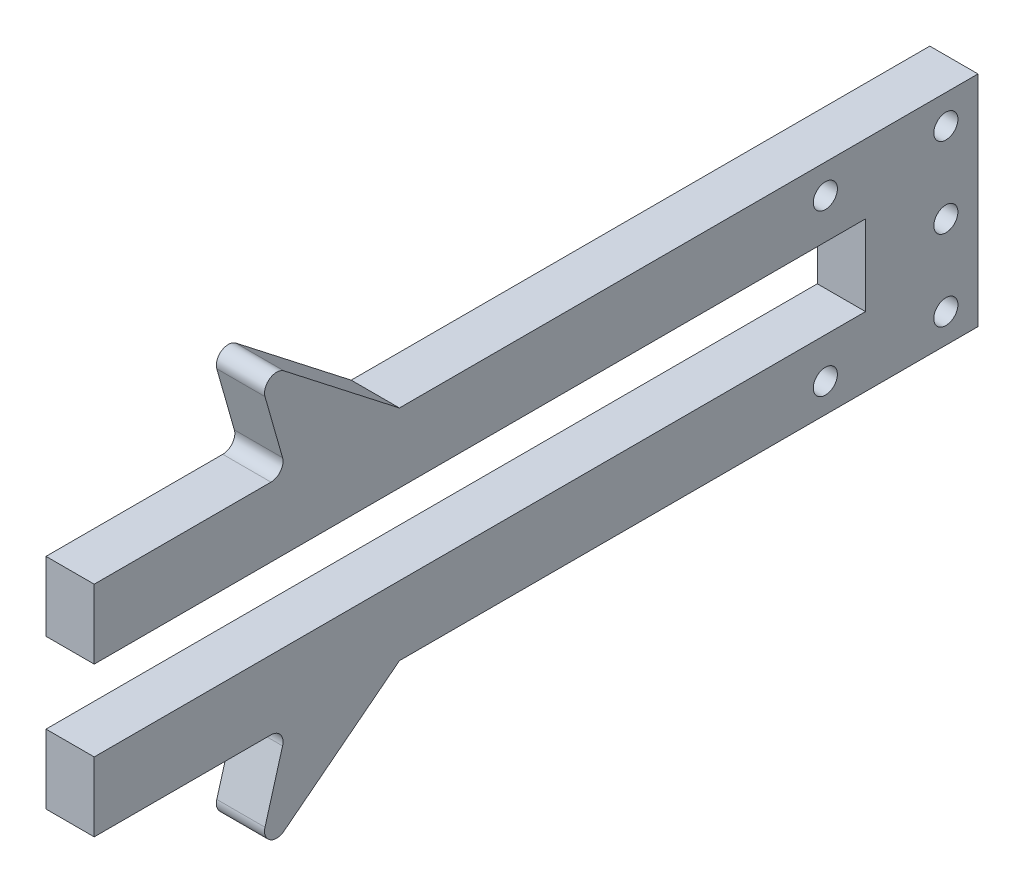
from build123d import *

# Parameters (mm, degrees)
BOSS_EXTRUDE1_DEPTH = 3
FILLET1_R           = 0.75
SKETCH3_R           = 0.75
CUT_EXTRUDE1_DEPTH  = 42.65740671


with BuildPart() as part:
    # Sketch2 → Boss-Extrude1 (new body)
    with BuildSketch(Plane(origin=(0, 0, 0), x_dir=(0, 0, -1), z_dir=(1, 0, 0))):
        Polygon((-20.913575794, -4.388518255), (-8.919601915, -4.388518255), (-10.913575794, 2.611481745), (-1.919601915, -4.388518255), (34.086424206, -4.388518255), (34.086424206, -18.00920791), (-1.919601915, -18.00920791), (-10.913575794, -25.00920791), (-8.919601915, -18.00920791), (-20.913575794, -18.00920791), (-20.913575794, -13.698863083), (27.086424206, -13.698863083), (27.086424206, -8.698863083), (-20.913575794, -8.698863083), align=None)
    extrude(amount=BOSS_EXTRUDE1_DEPTH)

    # Fillet1
    fillet1_edges = [part.edges().sort_by_distance(p)[0] for p in [
        (1.5, -25.00920791, 10.913575794),
        (1.5, -18.00920791, 8.919601915),
        (1.5, -4.388518255, 8.919601915),
        (1.5, 2.611481745, 10.913575794),
    ]]
    fillet(fillet1_edges, radius=FILLET1_R)

    # Sketch3 → Cut-Extrude1 (cut, through all)
    with BuildSketch(Plane(origin=(3, 0, 0), x_dir=(0, 0, -1), z_dir=(1, 0, 0))):
        with Locations((32.086424206, -6.198863083)):
            Circle(SKETCH3_R)
        with Locations((32.086424206, -16.198863083)):
            Circle(SKETCH3_R)
        with Locations((32.086424206, -11.198863083)):
            Circle(SKETCH3_R)
        with Locations((24.586424206, -6.198863083)):
            Circle(SKETCH3_R)
        with Locations((24.586424206, -16.198863083)):
            Circle(SKETCH3_R)
    extrude(amount=-CUT_EXTRUDE1_DEPTH, mode=Mode.SUBTRACT)


solid = part.part
